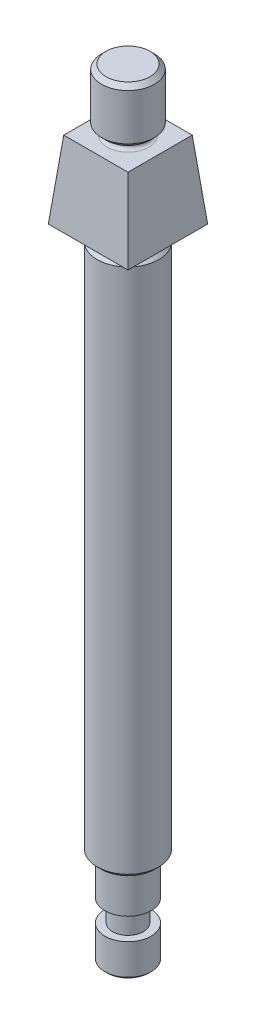
from build123d import *

# Parameters (mm, degrees)
SKETCH1_R           = 10.5
BOSS_EXTRUDE1_DEPTH = 42
SKETCH3_R           = 14
BOSS_EXTRUDE2_DEPTH = 243
SKETCH4_R           = 9
BOSS_EXTRUDE3_DEPTH = 5
SKETCH5_W           = 36.2
SKETCH5_H           = 36.2
BOSS_EXTRUDE4_DEPTH = 35
BOSS_EXTRUDE4_TAPER = 5.710593137
SKETCH6_R           = 8
BOSS_EXTRUDE6_DEPTH = 3
SKETCH7_R           = 12
BOSS_EXTRUDE7_DEPTH = 25
CHAMFER1_SIZE       = 2
FILLET2_R           = 2.5
SKETCH8_W           = 3.5
SKETCH8_H           = 10
CHAMFER2_SIZE       = 2
CHAMFER3_SIZE       = 1
FILLET3_R           = 1.5


with BuildPart() as part:
    # Sketch1 → Boss-Extrude1 (new body)
    with BuildSketch(Plane(origin=(0, 0, 0), x_dir=(1, 0, 0), z_dir=(0, 1, 0))):
        with Locations(Location((0, 0, 0), (0, 0, 90))):
            Circle(SKETCH1_R)
    extrude(amount=BOSS_EXTRUDE1_DEPTH)

    # Sketch3 → Boss-Extrude2 (add)
    with BuildSketch(Plane(origin=(0, 42, 0), x_dir=(1, 0, 0), z_dir=(0, 1, 0))):
        with Locations(Location((0, 0, 0), (0, 0, 270))):
            Circle(SKETCH3_R)
    extrude(amount=BOSS_EXTRUDE2_DEPTH)

    # Sketch4 → Boss-Extrude3 (add)
    with BuildSketch(Plane(origin=(0, 285, 0), x_dir=(1, 0, 0), z_dir=(0, 1, 0))):
        with Locations(Location((0, 0, 0), (0, 0, 270))):
            Circle(SKETCH4_R)
    extrude(amount=BOSS_EXTRUDE3_DEPTH)

    # Sketch5 → Boss-Extrude4 (add)
    with BuildSketch(Plane(origin=(0, 290, 0), x_dir=(1, 0, 0), z_dir=(0, 1, 0))):
        Rectangle(SKETCH5_W, SKETCH5_H)
    extrude(amount=BOSS_EXTRUDE4_DEPTH, taper=BOSS_EXTRUDE4_TAPER)

    # Sketch6 → Boss-Extrude6 (add)
    with BuildSketch(Plane(origin=(0, 325, 0), x_dir=(1, 0, 0), z_dir=(0, 1, 0))):
        with Locations(Location((0, 0, 0), (0, 0, 270))):
            Circle(SKETCH6_R)
    extrude(amount=BOSS_EXTRUDE6_DEPTH)

    # Sketch7 → Boss-Extrude7 (add)
    with BuildSketch(Plane(origin=(0, 328, 0), x_dir=(1, 0, 0), z_dir=(0, 1, 0))):
        with Locations(Location((0, 0, 0), (0, 0, 270))):
            Circle(SKETCH7_R)
    extrude(amount=BOSS_EXTRUDE7_DEPTH)

    # Chamfer1
    chamfer1_edges = [part.edges().sort_by_distance(p)[0] for p in [
        (0, 328, -12),
        (0, 353, -12),
    ]]
    chamfer(chamfer1_edges, length=CHAMFER1_SIZE)

    # Fillet2
    fillet2_edges = [part.edges().sort_by_distance(p)[0] for p in [
        (0, 290, -9),
        (0, 285, -9),
    ]]
    fillet(fillet2_edges, radius=FILLET2_R - 0.0001)  # a hair under: the kernel refuses the full size

    # Sketch8 → Cut-Revolve1 (revolve, cut)
    with BuildSketch(Plane.XY, mode=Mode.PRIVATE) as cut_revolve1_sk:
        with Locations((-8.75, 20)):
            Rectangle(SKETCH8_W, SKETCH8_H)
    revolve(cut_revolve1_sk.sketch.rotate(Axis((0, 42, 0), (0, -1, 0)), 90), axis=Axis((0, 42, 0), (0, -1, 0)), mode=Mode.SUBTRACT)

    # Chamfer2
    chamfer2_edges = [part.edges().sort_by_distance(p)[0] for p in [
        (0, 42, -14),
        (0, 285, -14),
    ]]
    chamfer(chamfer2_edges, length=CHAMFER2_SIZE)

    # Chamfer3
    chamfer3_edges = [part.edges().sort_by_distance(p)[0] for p in [
        (0, 0, 10.5),
    ]]
    chamfer(chamfer3_edges, length=CHAMFER3_SIZE)

    # Fillet3
    fillet3_edges = [part.edges().sort_by_distance(p)[0] for p in [
        (0, 325, -8),
        (0, 328, -8),
    ]]
    fillet(fillet3_edges, radius=FILLET3_R - 0.0001)  # a hair under: the kernel refuses the full size


solid = part.part
